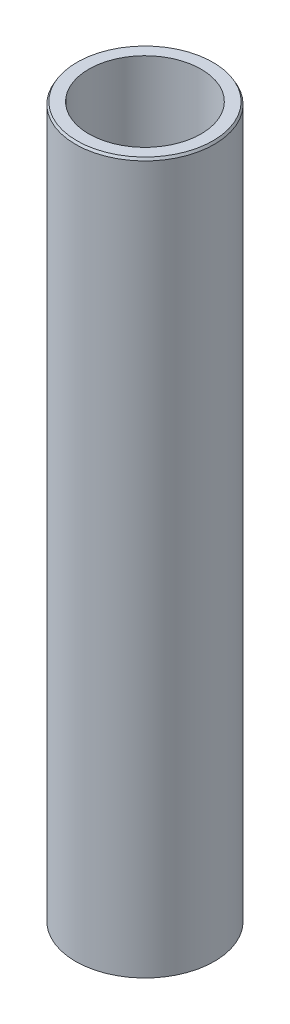
from build123d import *
from OCP.BRepFilletAPI import BRepFilletAPI_MakeChamfer

# Parameters (mm, degrees)
SKETCH1_R           = 57.5
BOSS_EXTRUDE1_DEPTH = 589.368917906
SKETCH2_R           = 46.520429008
CUT_EXTRUDE1_DEPTH  = 595.952284972
CHAMFER1_SIZE       = 1.988280655
CHAMFER1_SIZE2      = 1.147934372


with BuildPart() as part:
    # Sketch1 → Boss-Extrude1 (new body)
    with BuildSketch(Plane(origin=(0, 0, 0), x_dir=(1, 0, 0), z_dir=(0, 1, 0))):
        Circle(SKETCH1_R)
    extrude(amount=BOSS_EXTRUDE1_DEPTH)

    # Sketch2 → Cut-Extrude1 (cut, through all)
    with BuildSketch(Plane(origin=(0, 0, 0), x_dir=(1, 0, 0), z_dir=(0, 1, 0))):
        Circle(SKETCH2_R)
    extrude(amount=CUT_EXTRUDE1_DEPTH, mode=Mode.SUBTRACT)

    # Chamfer1: one chamfer whose edges measure the first distance from different faces: ONE call of the kernel's chamfer builder (chamfer() names one face for all edges)
    chamfer1_edges_1 = [part.edges().sort_by_distance(p)[0] for p in [
        (-57.5, 589.368917906, 0),
    ]]
    chamfer1_side_1 = [part.faces().sort_by_distance(p)[0] for p in [
        (-57.5, 294.684458953, 0),
    ]]
    chamfer1_edges_2 = [part.edges().sort_by_distance(p)[0] for p in [
        (-57.5, 0, 0),
    ]]
    chamfer1_side_2 = [part.faces().sort_by_distance(p)[0] for p in [
        (-55.873654403, 0, 0),
    ]]
    chamfer1 = BRepFilletAPI_MakeChamfer(part.part.solid().wrapped)
    for e in chamfer1_edges_1:
        chamfer1.Add(CHAMFER1_SIZE, CHAMFER1_SIZE2, e.wrapped, chamfer1_side_1[0].wrapped)  # the first distance lies on this face
    for e in chamfer1_edges_2:
        chamfer1.Add(CHAMFER1_SIZE, CHAMFER1_SIZE2, e.wrapped, chamfer1_side_2[0].wrapped)  # the first distance lies on this face
    add(Compound.cast(chamfer1.Shape()), mode=Mode.REPLACE)


solid = part.part
